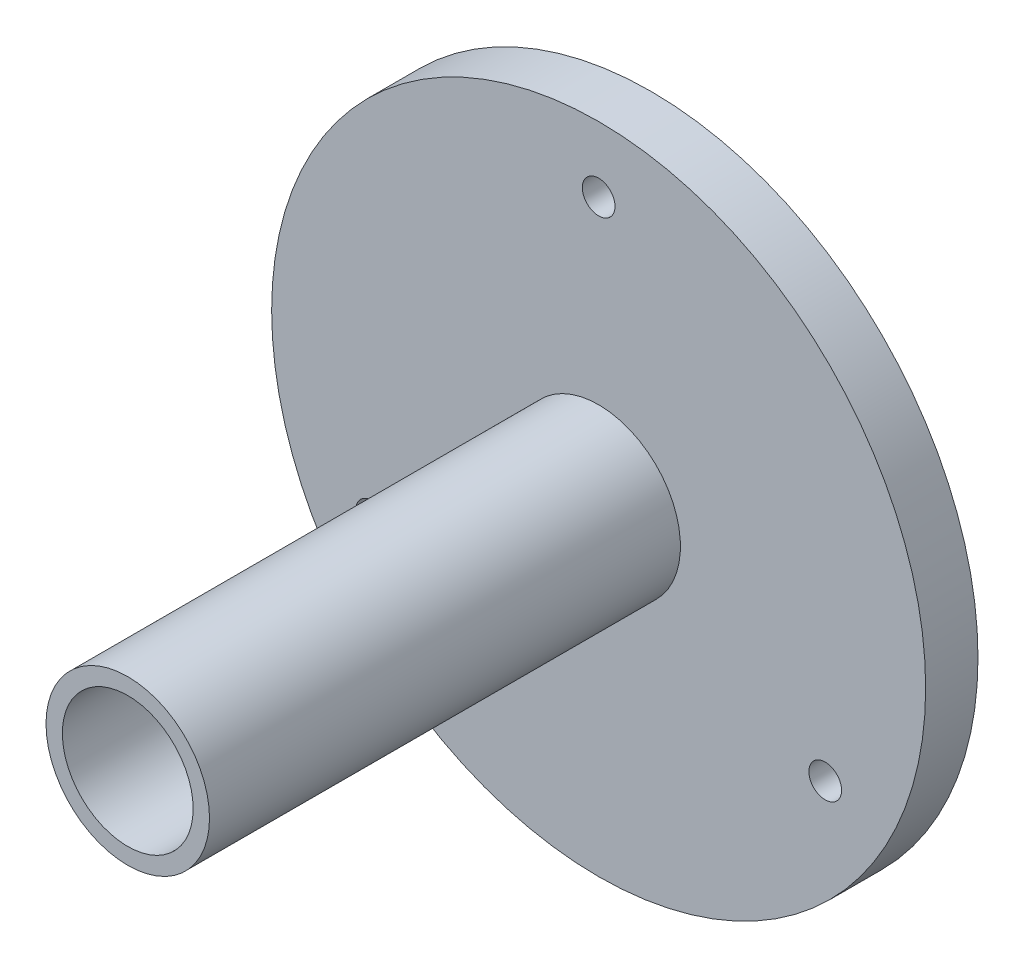
from build123d import *

# Parameters (mm, degrees)
SKETCH1_R           = 12.5
SKETCH1_R_2         = 10
BOSS_EXTRUDE1_DEPTH = 80
SKETCH2_R           = 50
SKETCH2_R_2         = 12.5
BOSS_EXTRUDE2_DEPTH = 8
SKETCH3_R           = 2.5
CUT_EXTRUDE1_DEPTH  = 8
CIRPATTERN1_COUNT   = 3


with BuildPart() as part:
    # Sketch1 → Boss-Extrude1 (new body)
    with BuildSketch(Plane.XY):
        Circle(SKETCH1_R)
        Circle(SKETCH1_R_2, mode=Mode.SUBTRACT)
    extrude(amount=BOSS_EXTRUDE1_DEPTH)

    # Sketch2 → Boss-Extrude2 (add)
    with BuildSketch(Plane(origin=(0, 0, 0), x_dir=(-1, 0, 0), z_dir=(0, 0, -1))):
        Circle(SKETCH2_R)
        Circle(SKETCH2_R_2, mode=Mode.SUBTRACT)
    extrude(amount=-BOSS_EXTRUDE2_DEPTH)

    # Sketch3 → Cut-Extrude1 (cut)
    with BuildSketch(Plane.XY.offset(8)):
        with Locations((0, 40)):
            Circle(SKETCH3_R)
    cut_extrude1 = extrude(amount=-CUT_EXTRUDE1_DEPTH, mode=Mode.SUBTRACT)

    # CirPattern1: Cut-Extrude1 ×3 about axis
    cirpattern1_axis = Axis((0, 0, 8), (0, 0, -1))
    for i in range(1, CIRPATTERN1_COUNT):
        add(cut_extrude1.rotate(cirpattern1_axis, i * 360 / CIRPATTERN1_COUNT), mode=Mode.SUBTRACT)


solid = part.part
